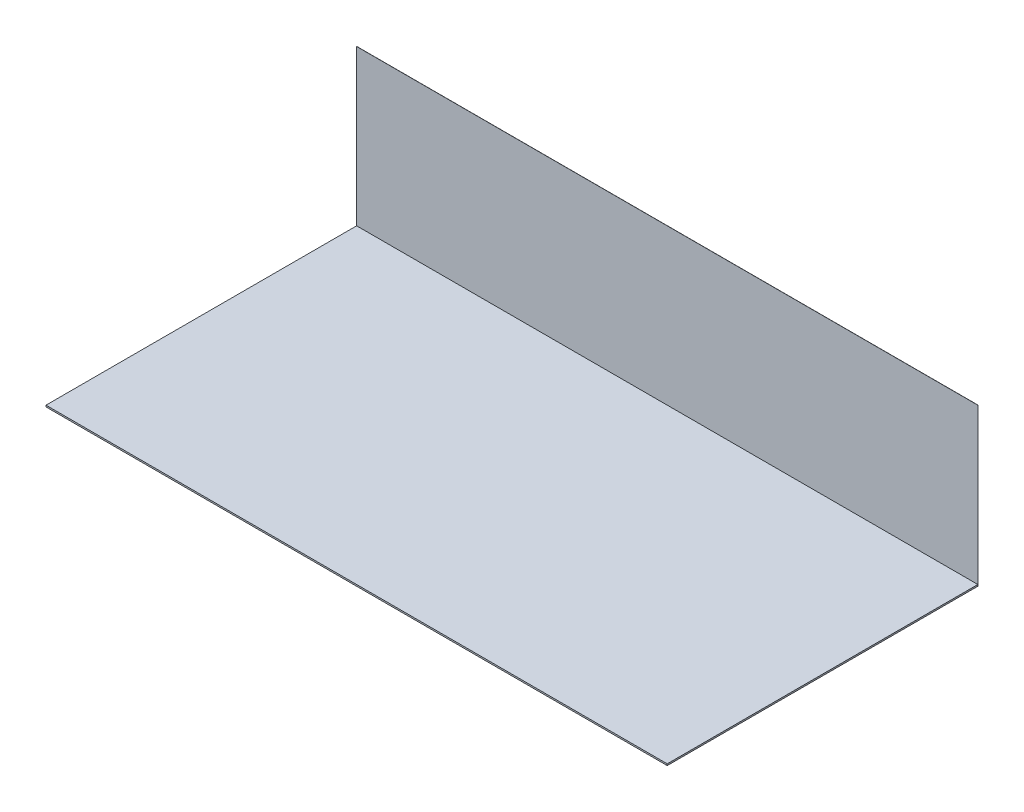
from build123d import *

# Parameters (mm, degrees)
SKETCH2_W     = 101.6
SKETCH2_H     = 50.8
FLOOR_2_DEPTH = 0.254
SKETCH4_W     = 101.6
SKETCH4_H     = 0.0254
WALL1_DEPTH   = 25.4


with BuildPart() as part:
    # Sketch2 → Floor 2 (new body)
    with BuildSketch(Plane(origin=(0, 0, 0), x_dir=(1, 0, 0), z_dir=(0, 1, 0))):
        with Locations((-32.22037037, -5.056481481)):
            Rectangle(SKETCH2_W, SKETCH2_H)
    extrude(amount=FLOOR_2_DEPTH)


with BuildPart() as body_2:
    # Sketch4 → Wall1 (new body)
    with BuildSketch(Plane(origin=(0, 0.254, 0), x_dir=(1, 0, 0), z_dir=(0, 1, 0))):
        with Locations((-32.22037037, 20.356218519)):
            Rectangle(SKETCH4_W, SKETCH4_H)
    extrude(amount=WALL1_DEPTH)


solid = Compound([part.part, body_2.part])
